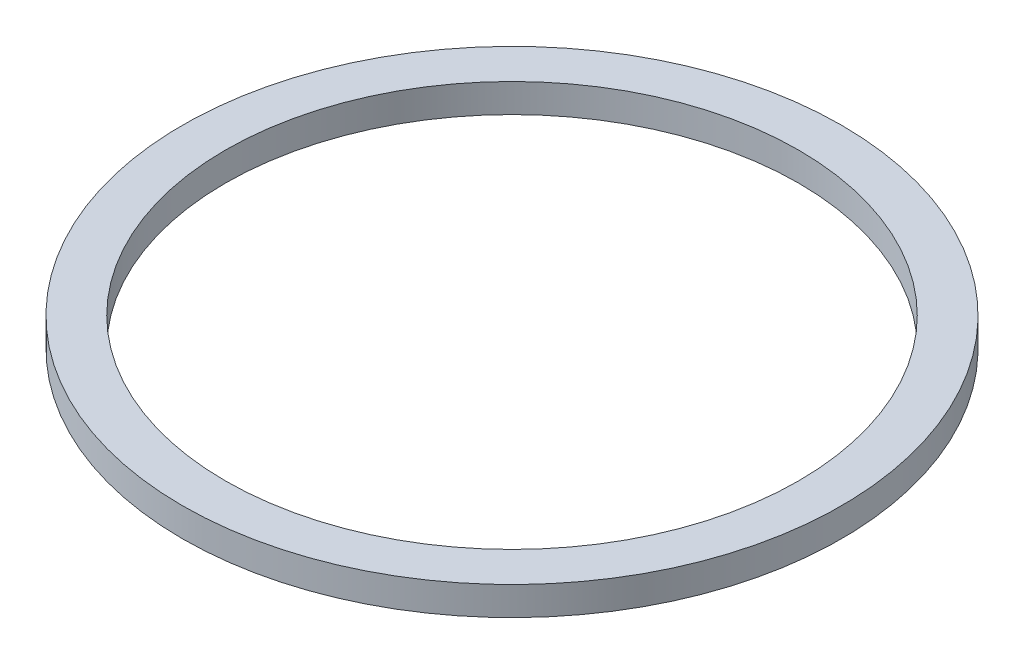
from build123d import *

# Parameters (mm, degrees)
SKETCH1_R           = 57.5
BOSS_EXTRUDE1_DEPTH = 5
SKETCH2_R           = 50
CUT_EXTRUDE1_DEPTH  = 82.470853684


with BuildPart() as part:
    # Sketch1 → Boss-Extrude1 (new body)
    with BuildSketch(Plane(origin=(0, 0, 0), x_dir=(1, 0, 0), z_dir=(0, 1, 0))):
        Circle(SKETCH1_R)
    extrude(amount=BOSS_EXTRUDE1_DEPTH)

    # Sketch2 → Cut-Extrude1 (cut, through all)
    with BuildSketch(Plane(origin=(0, 0, 0), x_dir=(1, 0, 0), z_dir=(0, 1, 0))):
        Circle(SKETCH2_R)
    extrude(amount=CUT_EXTRUDE1_DEPTH, mode=Mode.SUBTRACT)


solid = part.part
